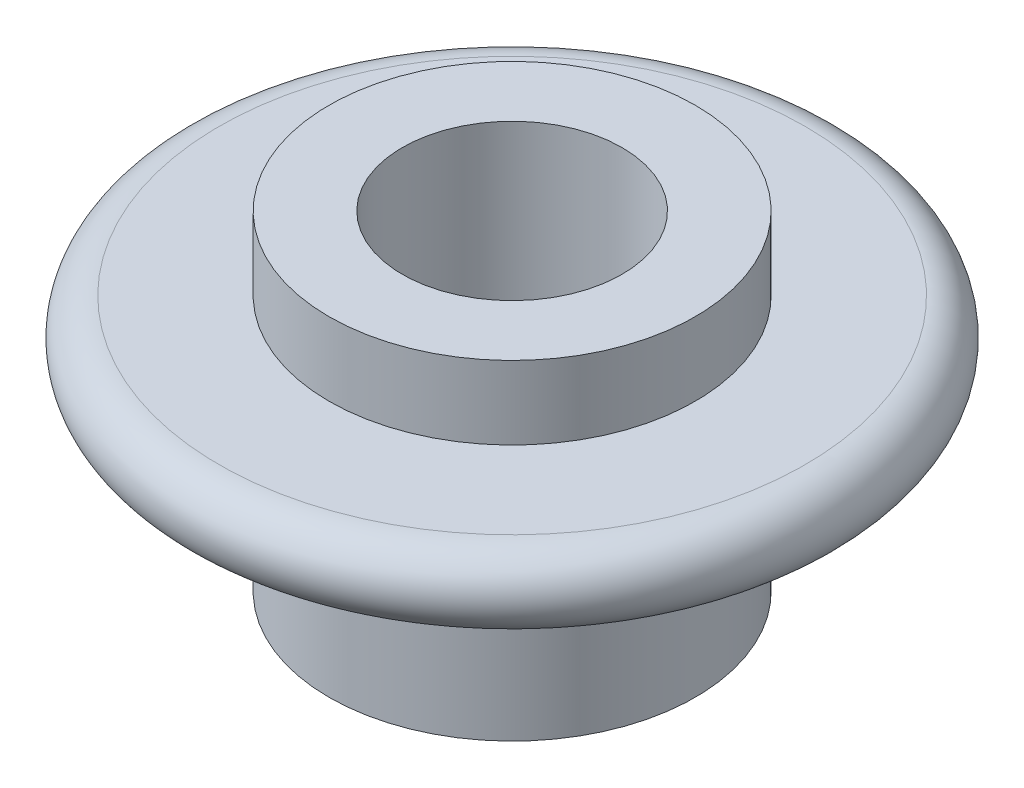
from build123d import *

# Parameters (mm, degrees)
REVOLVE_THIN2_START         = 6.945845758
REVOLVE_THIN2_OUTLINE_R     = 25
REVOLVE_THIN2_OUTLINE_R_2   = 15
REVOLVE_THIN2_DEPTH         = 45
REVOLVE_THIN2_START_2       = 31.945845758
REVOLVE_THIN2_2_OUTLINE_R   = 45
REVOLVE_THIN2_2_OUTLINE_R_2 = 25
REVOLVE_THIN2_2_DEPTH       = 10
FILLET4_R                   = 5


# Read off the part's stored shape, not the designer's step: Revolve-Thin2
with BuildPart() as part:
    # Revolve-Thin2 outline → Revolve-Thin2 (new body)
    with BuildSketch(Plane(origin=(0, 0, 0), x_dir=(1, 0, 0), z_dir=(0, 1, 0)).offset(REVOLVE_THIN2_START)):
        Circle(REVOLVE_THIN2_OUTLINE_R)
        Circle(REVOLVE_THIN2_OUTLINE_R_2, mode=Mode.SUBTRACT)
    extrude(amount=REVOLVE_THIN2_DEPTH)

    # Revolve-Thin2 2 outline → Revolve-Thin2 2 (add)
    with BuildSketch(Plane(origin=(0, 0, 0), x_dir=(1, 0, 0), z_dir=(0, 1, 0)).offset(REVOLVE_THIN2_START_2)):
        Circle(REVOLVE_THIN2_2_OUTLINE_R)
        Circle(REVOLVE_THIN2_2_OUTLINE_R_2, mode=Mode.SUBTRACT)
    extrude(amount=REVOLVE_THIN2_2_DEPTH)

    # Fillet4
    fillet4_edges = [part.edges().sort_by_distance(p)[0] for p in [
        (-45, 41.945845758, 0),
        (-45, 31.945845758, 0),
    ]]
    fillet(fillet4_edges, radius=FILLET4_R - 0.0001)  # a hair under: the kernel refuses the full size


solid = part.part
